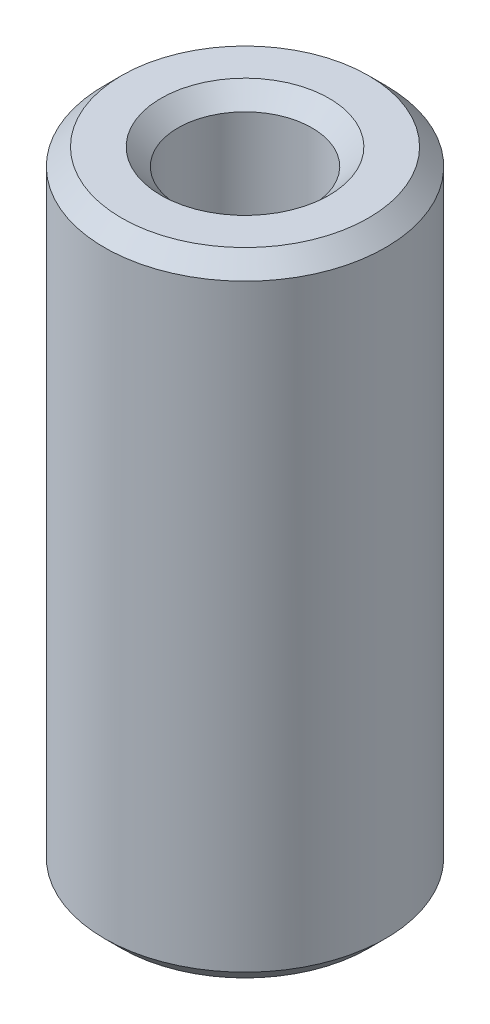
from build123d import *

# Parameters (mm, degrees)
SKETCH1_R           = 7.5
BOSS_EXTRUDE1_DEPTH = 33.764288304
SKETCH2_R           = 3.576231314
CUT_EXTRUDE1_DEPTH  = 36.391060519
CHAMFER1_SIZE       = 0.911260135


with BuildPart() as part:
    # Sketch1 → Boss-Extrude1 (new body)
    with BuildSketch(Plane(origin=(0, 0, 0), x_dir=(1, 0, 0), z_dir=(0, 1, 0))):
        Circle(SKETCH1_R)
    extrude(amount=BOSS_EXTRUDE1_DEPTH)

    # Sketch2 → Cut-Extrude1 (cut, through all)
    with BuildSketch(Plane(origin=(0, 0, 0), x_dir=(1, 0, 0), z_dir=(0, 1, 0))):
        Circle(SKETCH2_R)
    extrude(amount=CUT_EXTRUDE1_DEPTH, mode=Mode.SUBTRACT)

    # Chamfer1
    chamfer1_edges = [part.edges().sort_by_distance(p)[0] for p in [
        (-3.576231314, 33.764288304, 0),
        (-3.576231314, 0, 0),
        (-7.5, 0, 0),
        (-7.5, 33.764288304, 0),
    ]]
    chamfer(chamfer1_edges, length=CHAMFER1_SIZE)


solid = part.part
